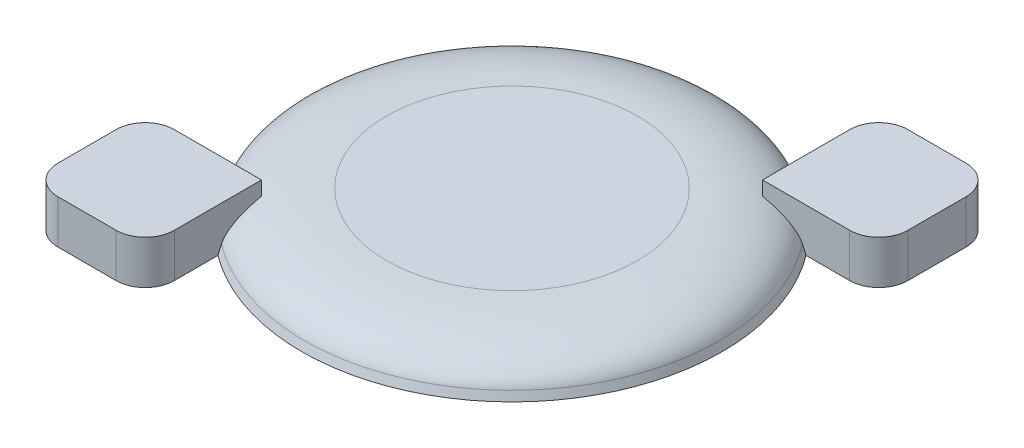
from build123d import *

# Parameters (mm, degrees)
SKETCH2_R                = 14.463803576
BOSS_EXTRUDE1_DEPTH      = 2.5
BOSS_EXTRUDE1_TAPER      = 20
SKETCH4_W                = 8
SKETCH4_H                = 8
BOSS_EXTRUDE2_DEPTH      = 3
FILLET2_R                = 2
CIRPATTERN1_COUNT        = 4
FILLET2_OF_CIRPATTERN1_R = 2


with BuildPart() as part:
    # Sketch2 → Boss-Extrude1 (new body)
    with BuildSketch(Plane(origin=(0, 0, 0), x_dir=(1, 0, 0), z_dir=(0, 1, 0))):
        Circle(SKETCH2_R)
    extrude(amount=BOSS_EXTRUDE1_DEPTH, taper=BOSS_EXTRUDE1_TAPER)

    # Fillet1
    # an asymmetric fillet: 6, 4 mm, written as the material it takes off along each edge
    with BuildSketch(Plane(origin=(0, 2.5, 0), x_dir=(1, 0, 0), z_dir=(0, 0, -1))) as fillet1_piece_1:
        with BuildLine():
            Bezier((14.262848017, 1.94787914), (13.55387799, 0), (8.624692292, 0), weights=[1, 0.819152044, 1])
            Line((8.624692292, 0), (13.55387799, 0))
            Line((13.55387799, 0), (14.262848017, 1.94787914))
        make_face()
    revolve(axis=Axis((0, 2.5, 0), (0, -1, 0)), mode=Mode.SUBTRACT)

    # Sketch4 → Boss-Extrude2 (add)
    with BuildSketch(Plane(origin=(0, 0, 0), x_dir=(1, 0, 0), z_dir=(0, 1, 0))):
        with Locations((-12.616427752, -12.616427752)):
            Rectangle(SKETCH4_W, SKETCH4_H)
    boss_extrude2 = extrude(amount=BOSS_EXTRUDE2_DEPTH)

    # Fillet2
    fillet2_edges = [part.edges().sort_by_distance(p)[0] for p in [
        (-8.616427752, 1.5, 16.616427752),
        (-16.616427752, 1.5, 8.616427752),
        (-16.616427752, 1.5, 16.616427752),
    ]]
    fillet(fillet2_edges, radius=FILLET2_R)

    # CirPattern1: Boss-Extrude2 ×4 about axis, 2 skipped
    cirpattern1_axis = Axis((0, 0, 0), (0, 1, 0))
    add([boss_extrude2.rotate(cirpattern1_axis, i * 360 / CIRPATTERN1_COUNT) for i in range(1, CIRPATTERN1_COUNT) if i not in (1, 3)])

    # Fillet2 of CirPattern1
    fillet2_of_cirpattern1_edges = [part.edges().sort_by_distance(p)[0] for p in [
        (8.616427752, 1.5, -16.616427752),
        (16.616427752, 1.5, -8.616427752),
        (16.616427752, 1.5, -16.616427752),
    ]]
    fillet(fillet2_of_cirpattern1_edges, radius=FILLET2_OF_CIRPATTERN1_R)


solid = part.part
